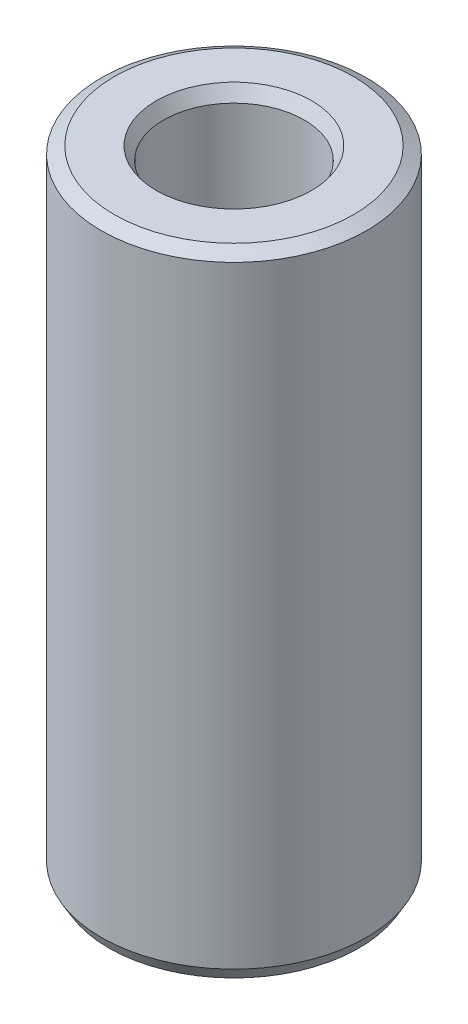
from build123d import *
from OCP.BRepFilletAPI import BRepFilletAPI_MakeChamfer

# Parameters (mm, degrees)
SKETCH1_R           = 35
BOSS_EXTRUDE1_DEPTH = 167.013474712
SKETCH2_R           = 18.563946069
CUT_EXTRUDE1_DEPTH  = 175.193859637
CHAMFER1_SIZE       = 1.966499876
CHAMFER1_SIZE2      = 3.406077699


with BuildPart() as part:
    # Sketch1 → Boss-Extrude1 (new body)
    with BuildSketch(Plane(origin=(0, 0, 0), x_dir=(1, 0, 0), z_dir=(0, 1, 0))):
        Circle(SKETCH1_R)
    extrude(amount=BOSS_EXTRUDE1_DEPTH)

    # Sketch2 → Cut-Extrude1 (cut, through all)
    with BuildSketch(Plane(origin=(0, 0, 0), x_dir=(1, 0, 0), z_dir=(0, 1, 0))):
        Circle(SKETCH2_R)
    extrude(amount=CUT_EXTRUDE1_DEPTH, mode=Mode.SUBTRACT)

    # Chamfer1: one chamfer whose edges measure the first distance from different faces: ONE call of the kernel's chamfer builder (chamfer() names one face for all edges)
    chamfer1_edges_1 = [part.edges().sort_by_distance(p)[0] for p in [
        (-18.563946069, 167.013474712, 0),
    ]]
    chamfer1_side_1 = [part.faces().sort_by_distance(p)[0] for p in [
        (-34.010050506, 167.013474712, 0),
    ]]
    chamfer1_edges_2 = [part.edges().sort_by_distance(p)[0] for p in [
        (-18.563946069, 0, 0),
    ]]
    chamfer1_side_2 = [part.faces().sort_by_distance(p)[0] for p in [
        (-18.563946069, 83.506737356, 0),
    ]]
    chamfer1_edges_3 = [part.edges().sort_by_distance(p)[0] for p in [
        (-35, 0, 0),
    ]]
    chamfer1_side_3 = [part.faces().sort_by_distance(p)[0] for p in [
        (-34.010050506, 0, 0),
    ]]
    chamfer1_edges_4 = [part.edges().sort_by_distance(p)[0] for p in [
        (-35, 167.013474712, 0),
    ]]
    chamfer1_side_4 = [part.faces().sort_by_distance(p)[0] for p in [
        (-35, 83.506737356, 0),
    ]]
    chamfer1 = BRepFilletAPI_MakeChamfer(part.part.solid().wrapped)
    for e in chamfer1_edges_1:
        chamfer1.Add(CHAMFER1_SIZE, CHAMFER1_SIZE2, e.wrapped, chamfer1_side_1[0].wrapped)  # the first distance lies on this face
    for e in chamfer1_edges_2:
        chamfer1.Add(CHAMFER1_SIZE, CHAMFER1_SIZE2, e.wrapped, chamfer1_side_2[0].wrapped)  # the first distance lies on this face
    for e in chamfer1_edges_3:
        chamfer1.Add(CHAMFER1_SIZE, CHAMFER1_SIZE2, e.wrapped, chamfer1_side_3[0].wrapped)  # the first distance lies on this face
    for e in chamfer1_edges_4:
        chamfer1.Add(CHAMFER1_SIZE, CHAMFER1_SIZE2, e.wrapped, chamfer1_side_4[0].wrapped)  # the first distance lies on this face
    add(Compound.cast(chamfer1.Shape()), mode=Mode.REPLACE)


solid = part.part
